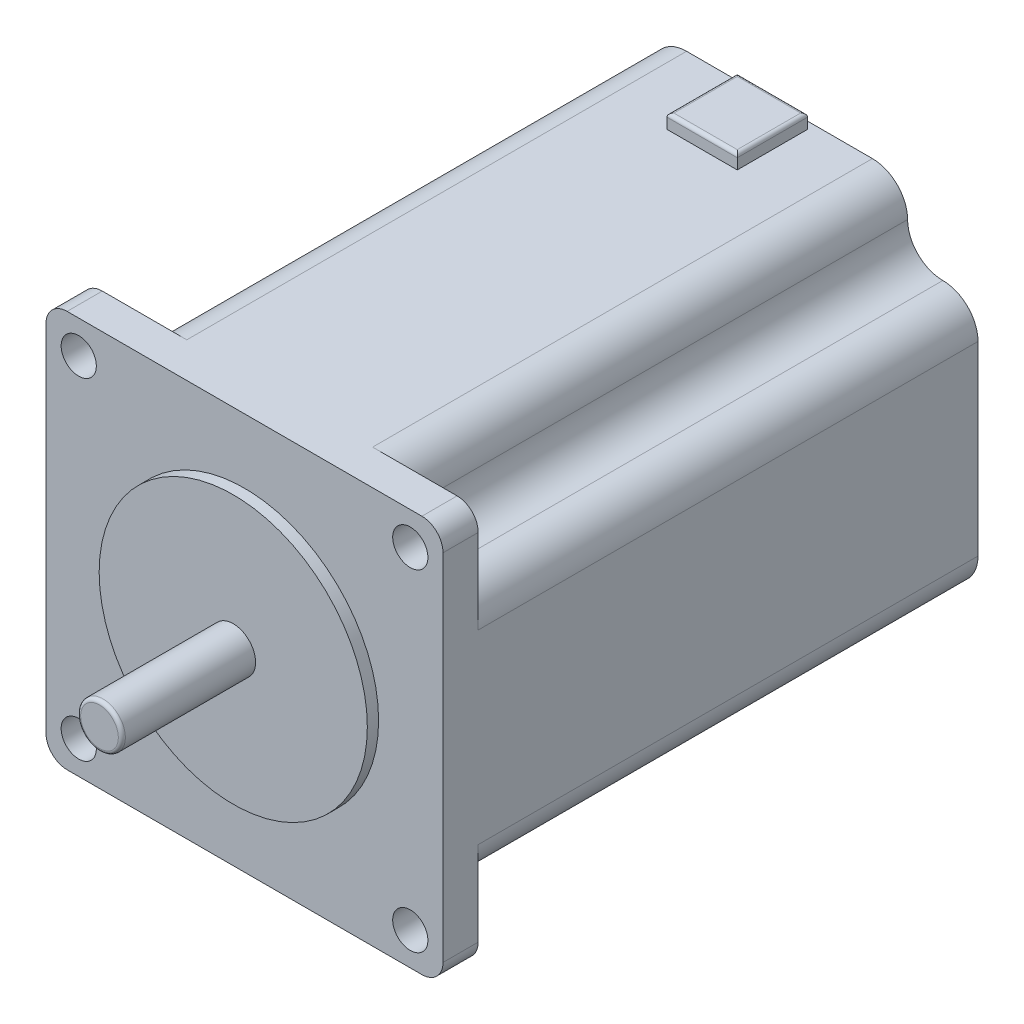
from build123d import *

# Parameters (mm, degrees)
SKETCH_1_W                  = 56.4
SKETCH_1_H                  = 56.4
EXTRUDE_1_DEPTH             = 76
SKETCH_2_R                  = 19.05
EXTRUDE_2_DEPTH             = 1.6
SKETCH_3_R                  = 3.175
EXTRUDE_3_DEPTH             = 19
SKETCH_4_R                  = 3.175
CUT_EXTRUDE_1_DEPTH         = 0.5
SKETCH_6_W                  = 10
SKETCH_6_H                  = 10
CUT_EXTRUDE_2_DEPTH         = 71
PATTERN_LINEAR_1_COUNT      = 2
PATTERN_LINEAR_1_PITCH      = 46.4
PATTERN_LINEAR_1_COUNT_DIR2 = 2
PATTERN_LINEAR_1_PITCH_DIR2 = 46.4
FILLET_1_R                  = 5
SKETCH_7_R                  = 2.5
CUT_EXTRUDE_3_DEPTH         = 71
PATTERN_LINEAR_2_COUNT      = 2
PATTERN_LINEAR_2_PITCH      = 47.1
PATTERN_LINEAR_2_COUNT_DIR2 = 2
PATTERN_LINEAR_2_PITCH_DIR2 = 47.1
FILLET_2_R                  = 3
FILLET_3_R                  = 0.5
SKETCH_8_W                  = 10
SKETCH_8_H                  = 10
EXTRUDE_4_DEPTH             = 2
FILLET_4_R                  = 0.5


with BuildPart() as part:
    # Эскиз1 → Бобышка-Вытянуть1 (new body)
    with BuildSketch(Plane.XY):
        Rectangle(SKETCH_1_W, SKETCH_1_H)
    extrude(amount=EXTRUDE_1_DEPTH)

    # Эскиз2 → Бобышка-Вытянуть2 (add)
    with BuildSketch(Plane.XY.offset(76)):
        Circle(SKETCH_2_R)
    extrude(amount=EXTRUDE_2_DEPTH)

    # Эскиз3 → Бобышка-Вытянуть3 (add)
    with BuildSketch(Plane.XY.offset(77.6)):
        Circle(SKETCH_3_R)
    extrude(amount=EXTRUDE_3_DEPTH)

    # Эскиз4 → Вырез-Вытянуть1 (cut)
    with BuildSketch(Plane(origin=(0, 0, 0), x_dir=(-1, 0, 0), z_dir=(0, 0, -1))):
        with Locations(Location((0, 0, 0), (0, 0, 180))):
            Circle(SKETCH_4_R)
    extrude(amount=-CUT_EXTRUDE_1_DEPTH, mode=Mode.SUBTRACT)

    # Эскиз6 → Вырез-Вытянуть2 (cut)
    with BuildSketch(Plane(origin=(0, 0, 0), x_dir=(-1, 0, 0), z_dir=(0, 0, -1))):
        with Locations((-23.2, 23.2)):
            Rectangle(SKETCH_6_W, SKETCH_6_H)
    cut_extrude_2 = extrude(amount=-CUT_EXTRUDE_2_DEPTH, mode=Mode.SUBTRACT)

    # Линейный массив1: Cut-Extrude 2 2 × 2
    with Locations(*[(-i * PATTERN_LINEAR_1_PITCH, -j * PATTERN_LINEAR_1_PITCH_DIR2, 0) for i in range(PATTERN_LINEAR_1_COUNT) for j in range(PATTERN_LINEAR_1_COUNT_DIR2) if (i, j) != (0, 0)]):
        add(cut_extrude_2, mode=Mode.SUBTRACT)

    # Скругление1
    fillet_1_edges = [part.edges().sort_by_distance(p)[0] for p in [
        (-28.2, 18.2, 35.5),
        (-28.2, -18.2, 35.5),
        (-18.2, -28.2, 35.5),
        (18.2, -28.2, 35.5),
        (28.2, -18.2, 35.5),
        (28.2, 18.2, 35.5),
        (-18.2, 28.2, 35.5),
        (18.2, 28.2, 35.5),
        (18.2, -18.2, 35.5),
        (-18.2, -18.2, 35.5),
        (-18.2, 18.2, 35.5),
        (18.2, 18.2, 35.5),
    ]]
    fillet(fillet_1_edges, radius=FILLET_1_R - 0.0001)  # a hair under: the kernel refuses the full size

    # Эскиз7 → Вырез-Вытянуть3 (cut)
    with BuildSketch(Plane.XY.offset(76)):
        with Locations((-23.55, 23.55)):
            Circle(SKETCH_7_R)
    cut_extrude_3 = extrude(amount=-CUT_EXTRUDE_3_DEPTH, mode=Mode.SUBTRACT)

    # Линейный массив2: Cut-Extrude 3 2 × 2
    with Locations(*[(i * PATTERN_LINEAR_2_PITCH, -j * PATTERN_LINEAR_2_PITCH_DIR2, 0) for i in range(PATTERN_LINEAR_2_COUNT) for j in range(PATTERN_LINEAR_2_COUNT_DIR2) if (i, j) != (0, 0)]):
        add(cut_extrude_3, mode=Mode.SUBTRACT)

    # Скругление2
    fillet_2_edges = [part.edges().sort_by_distance(p)[0] for p in [
        (28.2, -28.2, 73.5),
        (-28.2, -28.2, 73.5),
        (-28.2, 28.2, 73.5),
        (28.2, 28.2, 73.5),
    ]]
    fillet(fillet_2_edges, radius=FILLET_2_R)

    # Скругление3
    fillet_3_edges = [part.edges().sort_by_distance(p)[0] for p in [
        (-3.175, 0, 96.6),
    ]]
    fillet(fillet_3_edges, radius=FILLET_3_R)

    # Эскиз8 → Бобышка-Вытянуть4 (add)
    with BuildSketch(Plane(origin=(0, 28.2, 0), x_dir=(1, 0, 0), z_dir=(0, 1, 0))):
        with Locations((0, -6)):
            Rectangle(SKETCH_8_W, SKETCH_8_H)
    extrude(amount=EXTRUDE_4_DEPTH)

    # Скругление4
    fillet_4_edges = [part.edges().sort_by_distance(p)[0] for p in [
        (5, 30.2, 6),
        (0, 30.2, 1),
        (-5, 30.2, 6),
        (0, 30.2, 11),
    ]]
    fillet(fillet_4_edges, radius=FILLET_4_R)


solid = part.part
